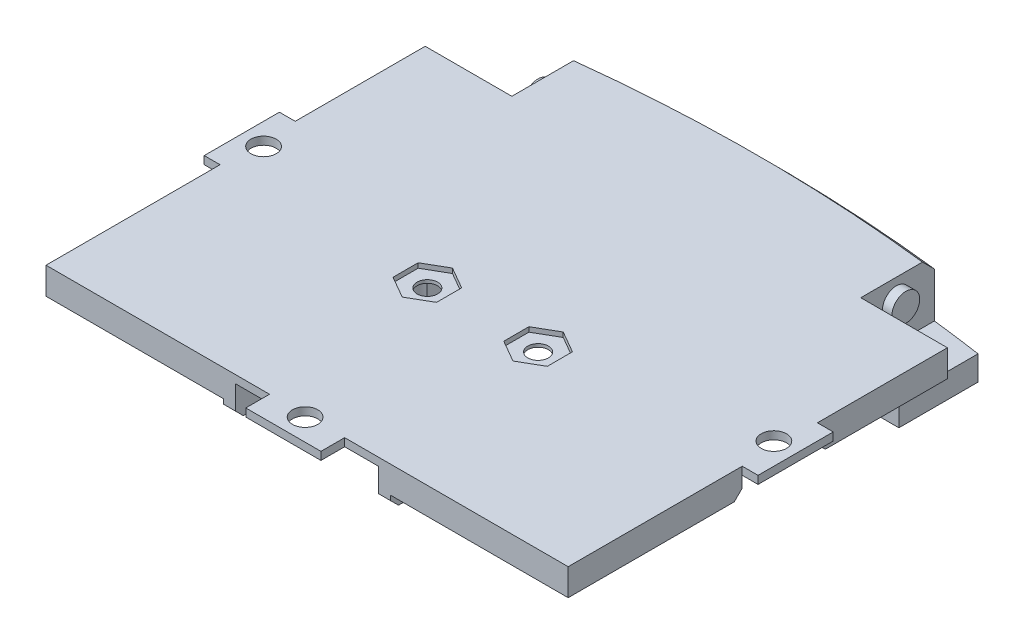
from build123d import *

# Parameters (mm, degrees)
SKETCH1_W            = 66
SKETCH1_H            = 100
BOSS_EXTRUDE1_DEPTH  = 1
CUT_EXTRUDE1_START   = -1
CUT_EXTRUDE1_DEPTH   = 1
CUT_EXTRUDE2_DEPTH   = 60.916608716
SKETCH4_W            = 70
SKETCH4_H            = 9.5
SKETCH4_W_2          = 9.5
SKETCH4_H_2          = 3
BOSS_EXTRUDE2_DEPTH  = 1
SKETCH5_R            = 1.6
CUT_EXTRUDE3_DEPTH   = 64.521649853
BOSS_EXTRUDE3_DEPTH  = 9.3
SKETCH7_W            = 18.1
SKETCH7_H            = 37.25
CUT_EXTRUDE4_DEPTH   = 2
SKETCH8_W            = 0.75
SKETCH8_H            = 35
BOSS_EXTRUDE4_DEPTH  = 1.9
SKETCH10_W           = 19.6
SKETCH10_H           = 14.249078429
CUT_EXTRUDE5_DEPTH   = 1.9
CUT_EXTRUDE6_DEPTH   = 65.191042989
BOSS_EXTRUDE7_START  = -9.3
BOSS_EXTRUDE7_DEPTH  = 9.3
BOSS_EXTRUDE8_START  = -9.3
BOSS_EXTRUDE8_DEPTH  = 9.3
CUT_EXTRUDE7_DEPTH   = 6.35
SKETCH18_R           = 1.75
BOSS_EXTRUDE9_DEPTH  = 1.2
CHAMFER1_SIZE        = 2
CHAMFER1_SIZE_2      = 1.753861884
CHAMFER2_SIZE        = 1.5
CHAMFER3_SIZE        = 2
CUT_EXTRUDE8_DEPTH   = 1
SKETCH20_W           = 1.5
SKETCH20_H           = 56.786035821
BOSS_EXTRUDE10_DEPTH = 4
BOSS_EXTRUDE11_DEPTH = 2.4
CHAMFER4_SIZE        = 1
SKETCH22_R           = 1.3
CUT_EXTRUDE9_DEPTH   = 1
SKETCH23_R           = 2.875
CUT_EXTRUDE10_DEPTH  = 4
CUT_EXTRUDE11_DEPTH  = 0.6


with BuildPart() as part:
    # Sketch1 → Boss-Extrude1 (new body)
    with BuildSketch(Plane(origin=(0, 0, 0), x_dir=(1, 0, 0), z_dir=(0, 1, 0))):
        Rectangle(SKETCH1_W, SKETCH1_H)
    extrude(amount=BOSS_EXTRUDE1_DEPTH)

    # Cut-Extrude1: read off the stored shape, not the designer's step
    # Cut-Extrude1 outline → Cut-Extrude1 (cut)
    with BuildSketch(Plane.XZ.offset(CUT_EXTRUDE1_START)):
        with BuildLine():
            ThreePointArc((33, 0.434794163), (30.75228798, 0.045949397), (28.5, -0.315448488))
            Line((28.5, -0.315448488), (28.5, -6.384127156))
            ThreePointArc((28.5, -6.384127156), (0, -8.5), (-28.5, -6.384127156))
            Line((-28.5, -6.384127156), (-28.5, -0.315448488))
            ThreePointArc((-28.5, -0.315448488), (-30.75228798, 0.045949397), (-33, 0.434794163))
            Line((-33, 0.434794163), (-33, -50))
            Line((-33, -50), (33, -50))
            Line((33, -50), (33, 0.434794163))
        make_face()
    extrude(amount=CUT_EXTRUDE1_DEPTH, mode=Mode.SUBTRACT)

    # Sketch3 → Cut-Extrude2 (cut, through all)
    with BuildSketch(Plane.XZ):
        with BuildLine():
            Line((-28.5, -0.315448488), (-28.5, -6.384127156))
            ThreePointArc((-28.5, -6.384127156), (-28.450000976, -6.391585578), (-28.4, -6.399030904))
            Line((-28.4, -6.399030904), (-28.4, -0.229667352))
            ThreePointArc((-28.4, -0.229667352), (-30.702389333, 0.139013646), (-33, 0.536389468))
            Line((-33, 0.536389468), (-33, 0.434794163))
            ThreePointArc((-33, 0.434794163), (-30.75228798, 0.045949397), (-28.5, -0.315448488))
        make_face()
        with BuildLine():
            Line((33, 0.536389468), (33, 0.434794163))
            ThreePointArc((33, 0.434794163), (30.75228798, 0.045949397), (28.5, -0.315448488))
            Line((28.5, -0.315448488), (28.5, -6.384127156))
            ThreePointArc((28.5, -6.384127156), (28.450000976, -6.391585578), (28.4, -6.399030904))
            Line((28.4, -6.399030904), (28.4, -0.229667352))
            ThreePointArc((28.4, -0.229667352), (30.702389333, 0.139013646), (33, 0.536389468))
        make_face()
    extrude(amount=-CUT_EXTRUDE2_DEPTH, mode=Mode.SUBTRACT)

    # Sketch4 → Boss-Extrude2 (add)
    with BuildSketch(Plane(origin=(0, 0, 0), x_dir=(-1, 0, 0), z_dir=(0, -1, 0))):
        with Locations((0, -23.25)):
            Rectangle(SKETCH4_W, SKETCH4_H)
        with Locations((0, -51.5)):
            Rectangle(SKETCH4_W_2, SKETCH4_H_2)
    extrude(amount=-BOSS_EXTRUDE2_DEPTH)

    # Sketch5 → Cut-Extrude3 (cut, through all)
    with BuildSketch(Plane.XZ):
        with Locations(Location((32.25, 23.25, 0), (0, 0, 270))):
            Circle(SKETCH5_R)
        with Locations(Location((-32.25, 23.25, 0), (0, 0, 270))):
            Circle(SKETCH5_R)
        with Locations(Location((0, 50.25, 0), (0, 0, 270))):
            Circle(SKETCH5_R)
    extrude(amount=-CUT_EXTRUDE3_DEPTH, mode=Mode.SUBTRACT)

    # Sketch6 → Boss-Extrude3 (add)
    with BuildSketch(Plane.XZ):
        with BuildLine():
            Line((28.4, -4.882390945), (28.4, -6.399030904))
            ThreePointArc((28.4, -6.399030904), (0, -8.5), (-28.4, -6.399030904))
            Line((-28.4, -6.399030904), (-28.4, -4.882390945))
            ThreePointArc((-28.4, -4.882390945), (0, -7), (28.4, -4.882390945))
        make_face()
    extrude(amount=BOSS_EXTRUDE3_DEPTH)

    # Sketch7 → Cut-Extrude4 (cut)
    with BuildSketch(Plane.XZ):
        with Locations((0, 11.125)):
            Rectangle(SKETCH7_W, SKETCH7_H)
    extrude(amount=CUT_EXTRUDE4_DEPTH, mode=Mode.SUBTRACT)

    # Sketch8 → Boss-Extrude4 (add)
    with BuildSketch(Plane.XZ):
        with Locations((-9.425, 10)):
            Rectangle(SKETCH8_W, SKETCH8_H)
        with Locations((9.425, 10)):
            Rectangle(SKETCH8_W, SKETCH8_H)
    extrude(amount=BOSS_EXTRUDE4_DEPTH)

    # Sketch10 → Cut-Extrude5 (cut)
    with BuildSketch(Plane.XZ):
        with Locations((0, 10.375460785)):
            Rectangle(SKETCH10_W, SKETCH10_H)
    extrude(amount=CUT_EXTRUDE5_DEPTH, mode=Mode.SUBTRACT)

    # Sketch12 → Cut-Extrude6 (cut, through all)
    with BuildSketch(Plane.XY):
        with BuildLine():
            Line((-2.93, -1.1), (2.93, -1.1))
            ThreePointArc((2.93, -1.1), (4.93, -3.1), (2.93, -5.1))
            Line((2.93, -5.1), (-2.93, -5.1))
            ThreePointArc((-2.93, -5.1), (-4.93, -3.1), (-2.93, -1.1))
        make_face()
    extrude(amount=-CUT_EXTRUDE6_DEPTH, mode=Mode.SUBTRACT)

    # Sketch14 → Boss-Extrude7 (add)
    with BuildSketch(Plane.XZ.offset(9.3).offset(BOSS_EXTRUDE7_START)):
        with BuildLine():
            Line((-28.4, -6.399030904), (-28.4, -0.229667352))
            Line((-28.4, -0.229667352), (-27.4, -0.229667352))
            Line((-27.4, -0.229667352), (-27.4, -6.545125559))
            ThreePointArc((-27.4, -6.545125559), (-27.900095626, -6.472732776), (-28.4, -6.399030904))
        make_face()
    boss_extrude7 = extrude(amount=BOSS_EXTRUDE7_DEPTH)

    # Mirror1: Boss-Extrude7 across plane
    add(boss_extrude7.mirror(Plane(origin=(0, 0, 0), x_dir=(0, 0, 1), z_dir=(1, 0, 0))))

    # Sketch16 → Boss-Extrude8 (add)
    with BuildSketch(Plane.XZ.offset(9.3).offset(BOSS_EXTRUDE8_START)):
        with BuildLine():
            Line((28.4, -6.399030904), (28.4, 3.600969096))
            Line((28.4, 3.600969096), (19.9, 3.600969096))
            Line((19.9, 3.600969096), (19.9, -7.471325984))
            ThreePointArc((19.9, -7.471325984), (24.155950699, -6.982349176), (28.4, -6.399030904))
        make_face()
    boss_extrude8 = extrude(amount=BOSS_EXTRUDE8_DEPTH)

    # Sketch17 → Cut-Extrude7 (cut)
    with BuildSketch(Plane(origin=(28.4, 0, 0), x_dir=(0, 0, -1), z_dir=(1, 0, 0))):
        with BuildLine():
            Line((2.428677783, -6.2), (8.5, -6.2))
            Line((8.5, -6.2), (8.5, 1))
            Line((8.5, 1), (-2.071322217, 1))
            Line((-2.071322217, 1), (-2.071322217, -1.7))
            ThreePointArc((-2.071322217, -1.7), (-0.753302732, -4.881980515), (2.428677783, -6.2))
        make_face()
    cut_extrude7 = extrude(amount=-CUT_EXTRUDE7_DEPTH, mode=Mode.SUBTRACT)

    # Sketch18 → Boss-Extrude9 (add)
    with BuildSketch(Plane(origin=(22.05, 0, 0), x_dir=(0, 0, -1), z_dir=(1, 0, 0))):
        with Locations((2.428677783, -1.7)):
            Circle(SKETCH18_R)
    boss_extrude9 = extrude(amount=BOSS_EXTRUDE9_DEPTH)

    # Mirror5: Boss-Extrude8, Cut-Extrude7, Boss-Extrude9 across plane
    add(boss_extrude8.mirror(Plane(origin=(0, 0, 0), x_dir=(0, 0, 1), z_dir=(1, 0, 0))))
    add(cut_extrude7.mirror(Plane(origin=(0, 0, 0), x_dir=(0, 0, 1), z_dir=(1, 0, 0))), mode=Mode.SUBTRACT)
    add(boss_extrude9.mirror(Plane(origin=(0, 0, 0), x_dir=(0, 0, 1), z_dir=(1, 0, 0))))

    # Chamfer1
    # the kernel refuses this chamfer: 2, 1.753861884 mm, written as the material it takes off along each edge
    with BuildSketch(Plane(origin=(-28.4, -5.143365976, -0.229667352), x_dir=(0, 0, 1), z_dir=(0, 1, 0))) as chamfer1_piece_1:
        with BuildLine():
            Line((CHAMFER1_SIZE, 0), (0.273671674, -1.726328326))
            ThreePointArc((0.273671674, -1.726328326), (0.138499154, -0.886697037), (0, 0))
            Line((0, 0), (CHAMFER1_SIZE, 0))
        make_face()
    extrude(amount=11.286731952, mode=Mode.SUBTRACT)
    with BuildSketch(Plane(origin=(28.4, -5.116242352, -0.229667352), x_dir=(0.987565010261834, 0, 0.1572111653367653), z_dir=(0, 1, 0))) as chamfer1_piece_2:
        with BuildLine():
            Line((1.989439971, 0), (CHAMFER1_SIZE_2 * 0.157211165371, -CHAMFER1_SIZE_2 * 0.987565010478))
            Line((CHAMFER1_SIZE_2 * 0.157211165371, -CHAMFER1_SIZE_2 * 0.987565010478), (0, 0))
            ThreePointArc((0, 0), (1.02284944, 0.002644953), (1.989439971, 0))
        make_face()
    extrude(amount=11.232484704, mode=Mode.SUBTRACT)

    # Chamfer2
    chamfer2_edges = [part.edges().sort_by_distance(p)[0] for p in [
        (0, 1, -8.5),
    ]]
    chamfer(chamfer2_edges, length=CHAMFER2_SIZE)

    # Chamfer3
    # the kernel refuses this chamfer: 2 mm, written as the material it adds along each edge
    with BuildSketch(Plane(origin=(0, 0, 184.5), x_dir=(-0.1305886688100571, 0, -0.9914366341720571), z_dir=(-0.9914366341720571, 0, 0.1305886688100571))) as chamfer3_piece_1_section:
        Polygon((191.5 - CHAMFER3_SIZE, 0), (191.5, CHAMFER3_SIZE), (191.5, 0), align=None)
    chamfer3_piece_1 = revolve(axis=Axis((0, 0, 184.5), (0, -1, 0)), revolution_arc=6.10908985, mode=Mode.PRIVATE)
    chamfer3_piece_1 = split(chamfer3_piece_1, bisect_by=Plane(origin=(-9.8, 0, 184.5), z_dir=(-1, 0, 0)), keep=Keep.TOP, mode=Mode.PRIVATE)
    chamfer3_piece_1 = split(chamfer3_piece_1, bisect_by=Plane(origin=(-19.9, 0, 184.5), z_dir=(1, 0, 0)), keep=Keep.TOP, mode=Mode.PRIVATE)
    chamfer3_piece_1 = split(chamfer3_piece_1, bisect_by=Plane(origin=(0, -2, 184.5), z_dir=(0, 1, 0)), keep=Keep.TOP, mode=Mode.PRIVATE)
    add(chamfer3_piece_1)
    with BuildSketch(Plane(origin=(0, 0, 184.5), x_dir=(-0.1305886688100571, 0, -0.9914366341720571), z_dir=(-0.9914366341720571, 0, 0.1305886688100571))) as chamfer3_piece_2_section:
        Polygon((191.5 - CHAMFER3_SIZE, 0), (191.5, CHAMFER3_SIZE), (191.5, 0), align=None)
    chamfer3_piece_2 = revolve(axis=Axis((0, 0, 184.5), (0, -1, 0)), revolution_arc=6.10908985, mode=Mode.PRIVATE)
    chamfer3_piece_2 = split(chamfer3_piece_2, bisect_by=Plane(origin=(-9.8, 0, 184.5), z_dir=(1, 0, 0)), keep=Keep.TOP, mode=Mode.PRIVATE)
    chamfer3_piece_2 = split(chamfer3_piece_2, bisect_by=Plane(origin=(-9.05, 0, 184.5), z_dir=(-1, 0, 0)), keep=Keep.TOP, mode=Mode.PRIVATE)
    chamfer3_piece_2 = split(chamfer3_piece_2, bisect_by=Plane(origin=(0, -2, 184.5), z_dir=(0, 1, 0)), keep=Keep.TOP, mode=Mode.PRIVATE)
    add(chamfer3_piece_2)
    with BuildSketch(Plane(origin=(0, 0, 184.5), x_dir=(0.0243365747300663, 0, -0.9997038217044125), z_dir=(-0.9997038217044125, 0, -0.0243365747300663))) as chamfer3_piece_3_section:
        Polygon((191.5 - CHAMFER3_SIZE, 0), (191.5, CHAMFER3_SIZE), (191.5, 0), align=None)
    chamfer3_piece_3 = revolve(axis=Axis((0, 0, 184.5), (0, -1, 0)), revolution_arc=6.10908985, mode=Mode.PRIVATE)
    chamfer3_piece_3 = split(chamfer3_piece_3, bisect_by=Plane(origin=(9.8, 0, 184.5), z_dir=(-1, 0, 0)), keep=Keep.TOP, mode=Mode.PRIVATE)
    chamfer3_piece_3 = split(chamfer3_piece_3, bisect_by=Plane(origin=(0, -2, 184.5), z_dir=(0, 1, 0)), keep=Keep.TOP, mode=Mode.PRIVATE)
    chamfer3_piece_3 = split(chamfer3_piece_3, bisect_by=Plane(origin=(9.05, 0, 184.5), z_dir=(1, 0, 0)), keep=Keep.TOP, mode=Mode.PRIVATE)
    add(chamfer3_piece_3)
    with BuildSketch(Plane(origin=(0, 0, 184.5), x_dir=(0.0243365747300663, 0, -0.9997038217044125), z_dir=(-0.9997038217044125, 0, -0.0243365747300663))) as chamfer3_piece_4_section:
        Polygon((191.5 - CHAMFER3_SIZE, 0), (191.5, CHAMFER3_SIZE), (191.5, 0), align=None)
    chamfer3_piece_4 = revolve(axis=Axis((0, 0, 184.5), (0, -1, 0)), revolution_arc=6.10908985, mode=Mode.PRIVATE)
    chamfer3_piece_4 = split(chamfer3_piece_4, bisect_by=Plane(origin=(19.9, 0, 184.5), z_dir=(-1, 0, 0)), keep=Keep.TOP, mode=Mode.PRIVATE)
    chamfer3_piece_4 = split(chamfer3_piece_4, bisect_by=Plane(origin=(9.8, 0, 184.5), z_dir=(1, 0, 0)), keep=Keep.TOP, mode=Mode.PRIVATE)
    chamfer3_piece_4 = split(chamfer3_piece_4, bisect_by=Plane(origin=(0, -2, 184.5), z_dir=(0, 1, 0)), keep=Keep.TOP, mode=Mode.PRIVATE)
    add(chamfer3_piece_4)

    # Sketch19 → Cut-Extrude8 (cut)
    with BuildSketch(Plane.XZ):
        with BuildLine():
            Line((-28.4, 2.071322217), (-33, 2.071322217))
            Line((-33, 2.071322217), (-33, 0.536389468))
            ThreePointArc((-33, 0.536389468), (-31.564124299, 0.284593323), (-30.126328326, 0.044004322))
            Line((-30.126328326, 0.044004322), (-28.4, 1.770332648))
            Line((-28.4, 1.770332648), (-28.4, 2.071322217))
        make_face()
        with BuildLine():
            Line((33, 2.071322217), (33, 0.536389468))
            ThreePointArc((33, 0.536389468), (31.68316133, 0.305029145), (30.364701305, 0.083094824))
            Line((30.364701305, 0.083094824), (28.4, 1.524194532))
            Line((28.4, 1.524194532), (28.4, 2.071322217))
            Line((28.4, 2.071322217), (33, 2.071322217))
        make_face()
    extrude(amount=-CUT_EXTRUDE8_DEPTH, mode=Mode.SUBTRACT)

    # Sketch20 → Boss-Extrude10 (add)
    with BuildSketch(Plane.XZ):
        with Locations((-9.8, 21.60698209)):
            Rectangle(SKETCH20_W, SKETCH20_H)
        with Locations((9.8, 21.60698209)):
            Rectangle(SKETCH20_W, SKETCH20_H)
    extrude(amount=BOSS_EXTRUDE10_DEPTH)

    # Sketch21 → Boss-Extrude11 (add)
    with BuildSketch(Plane.XZ):
        Polygon((33, 50), (33, 28), (31.5, 28), (31.5, 48.5), (10.55, 48.5), (10.55, 50), align=None)
        Polygon((-33, 28), (-33, 50), (-10.55, 50), (-10.55, 48.5), (-31.5, 48.5), (-31.5, 28), align=None)
        Polygon((33, 18.5), (33, 2.071322217), (28.4, 2.071322217), (28.4, 3.571322217), (31.5, 3.571322217), (31.5, 18.5), align=None)
        Polygon((-28.4, 2.071322217), (-33, 2.071322217), (-33, 18.5), (-31.5, 18.5), (-31.5, 3.571322217), (-28.4, 3.571322217), align=None)
    extrude(amount=BOSS_EXTRUDE11_DEPTH)

    # Chamfer4
    chamfer4_edges = [part.edges().sort_by_distance(p)[0] for p in [
        (-9.8, -4, 50),
        (9.8, -4, 50),
        (32.25, -2.4, 28),
        (-32.25, -2.4, 28),
        (32.25, -2.4, 18.5),
        (-32.25, -2.4, 18.5),
    ]]
    chamfer(chamfer4_edges, length=CHAMFER4_SIZE)

    # Sketch22 → Cut-Extrude9 (cut)
    with BuildSketch(Plane.XZ):
        with Locations(Location((-7, 27.8, 0), (0, 0, 270))):
            Circle(SKETCH22_R)
        with Locations(Location((7, 27.8, 0), (0, 0, 270))):
            Circle(SKETCH22_R)
    extrude(amount=-CUT_EXTRUDE9_DEPTH, mode=Mode.SUBTRACT)

    # Sketch23 → Cut-Extrude10 (cut)
    with BuildSketch(Plane.XZ.offset(4)):
        with Locations((-7, 27.8)):
            Circle(SKETCH23_R)
        with Locations((7, 27.8)):
            Circle(SKETCH23_R)
    extrude(amount=-CUT_EXTRUDE10_DEPTH, mode=Mode.SUBTRACT)

    # Sketch24 → Cut-Extrude11 (cut)
    with BuildSketch(Plane(origin=(0, 1, 0), x_dir=(1, 0, 0), z_dir=(0, 1, 0))):
        Polygon((-9.75, -26.21228676), (-9.75, -29.38771324), (-7, -30.975426481), (-4.25, -29.38771324), (-4.25, -26.21228676), (-7, -24.624573519), align=None)
        Polygon((7, -24.624573519), (4.25, -26.21228676), (4.25, -29.38771324), (7, -30.975426481), (9.75, -29.38771324), (9.75, -26.21228676), align=None)
    extrude(amount=-CUT_EXTRUDE11_DEPTH, mode=Mode.SUBTRACT)


solid = part.part
